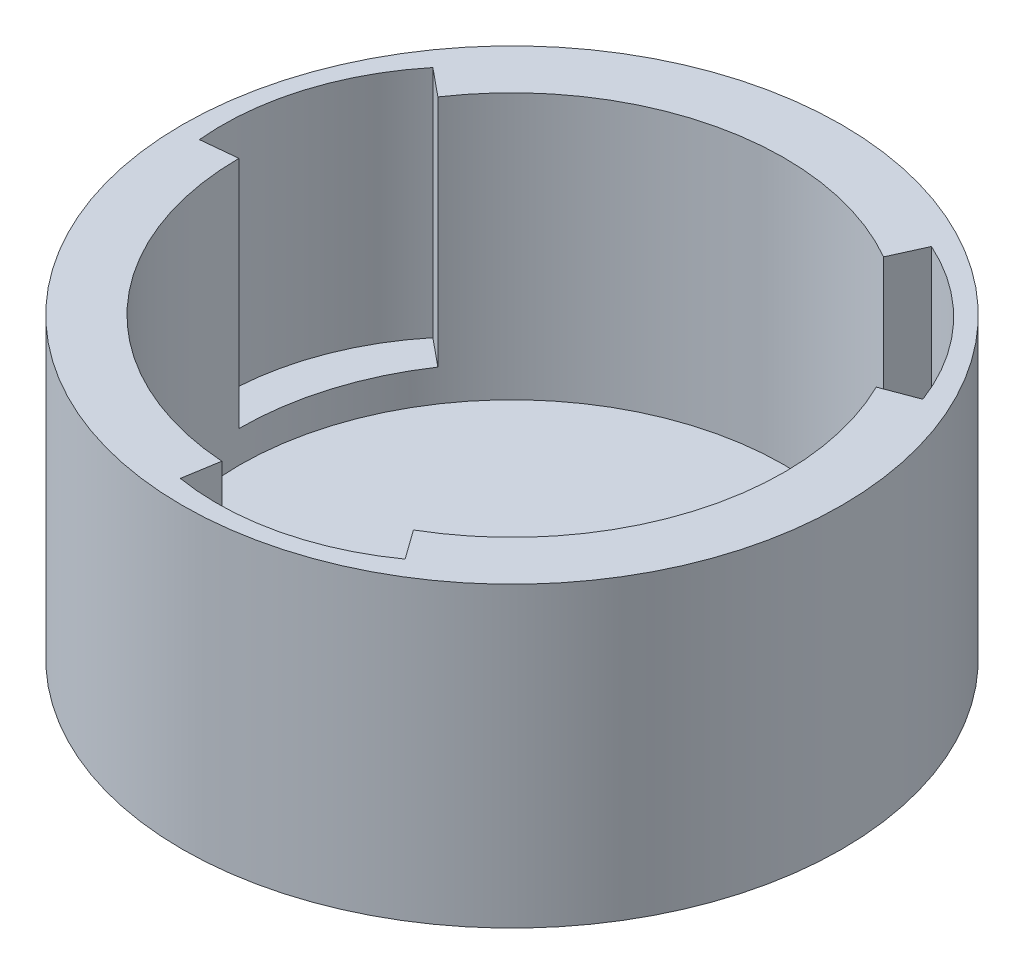
from build123d import *

# Parameters (mm, degrees)
SKETCH1_R           = 31
BOSS_EXTRUDE1_DEPTH = 3
SKETCH2_R           = 31
SKETCH2_R_2         = 25.6
BOSS_EXTRUDE2_DEPTH = 25
SKETCH4_R           = 9
CUT_EXTRUDE1_DEPTH  = 51.467811524
CAVITY1_START       = 6
CAVITY1_DEPTH       = 22


# Read off the part's stored shape, not the designer's step: Cavity1
with BuildPart() as part:
    # Sketch1 → Boss-Extrude1 (new body)
    with BuildSketch(Plane(origin=(0, 0, 0), x_dir=(1, 0, 0), z_dir=(0, 1, 0))):
        with Locations(Location((0, 0, 0), (0, 0, 270))):
            Circle(SKETCH1_R)
    extrude(amount=BOSS_EXTRUDE1_DEPTH)

    # Sketch2 → Boss-Extrude2 (add)
    with BuildSketch(Plane(origin=(0, 3, 0), x_dir=(1, 0, 0), z_dir=(0, 1, 0))):
        with Locations(Location((0, 0, 0), (0, 0, 270))):
            Circle(SKETCH2_R)
        with Locations(Location((0, 0, 0), (0, 0, 270))):
            Circle(SKETCH2_R_2, mode=Mode.SUBTRACT)
    extrude(amount=BOSS_EXTRUDE2_DEPTH)

    # Sketch4 → Cut-Extrude1 (cut, through all)
    with BuildSketch(Plane(origin=(0, 3, 0), x_dir=(1, 0, 0), z_dir=(0, 1, 0))):
        with Locations(Location((0, 0, 0), (0, 0, 270))):
            Circle(SKETCH4_R)
    extrude(amount=-CUT_EXTRUDE1_DEPTH, mode=Mode.SUBTRACT)

    # Cavity1 outline → Cavity1 (cut)
    with BuildSketch(Plane(origin=(0, 0, 0), x_dir=(1, 0, 0), z_dir=(0, 1, 0)).offset(CAVITY1_START)):
        with BuildLine():
            ThreePointArc((-2.295619613, -28.894863729), (6.673679903, -28.599701426), (14.847278424, -24.894604691))
            Line((14.847278424, -24.894604691), (12.866647777, -22.131637422))
            ThreePointArc((12.866647777, -22.131637422), (5.817422257, -24.930254677), (-1.742424083, -25.540633475))
            Line((-1.742424083, -25.540633475), (-2.295619613, -28.894863729))
        make_face()
        with BuildLine():
            Line((-28.982999292, -0.410817947), (-25.599884123, -0.077025125))
            ThreePointArc((-25.599884123, -0.077025125), (-24.498945002, 7.427091879), (-21.247625377, 14.279300258))
            Line((-21.247625377, 14.279300258), (-23.875876221, 16.435496767))
            ThreePointArc((-23.875876221, 16.435496767), (-28.104907927, 8.52027438), (-28.982999292, -0.410817947))
        make_face()
        with BuildLine():
            ThreePointArc((12.733236347, 22.208662547), (18.681522745, 17.503162798), (22.99004946, 11.261333217))
            Line((22.99004946, 11.261333217), (26.171495835, 12.459366962))
            ThreePointArc((26.171495835, 12.459366962), (21.431228024, 20.079427046), (14.135720867, 25.305422638))
            Line((14.135720867, 25.305422638), (12.733236347, 22.208662547))
        make_face()
    extrude(amount=CAVITY1_DEPTH, mode=Mode.SUBTRACT)


solid = part.part
